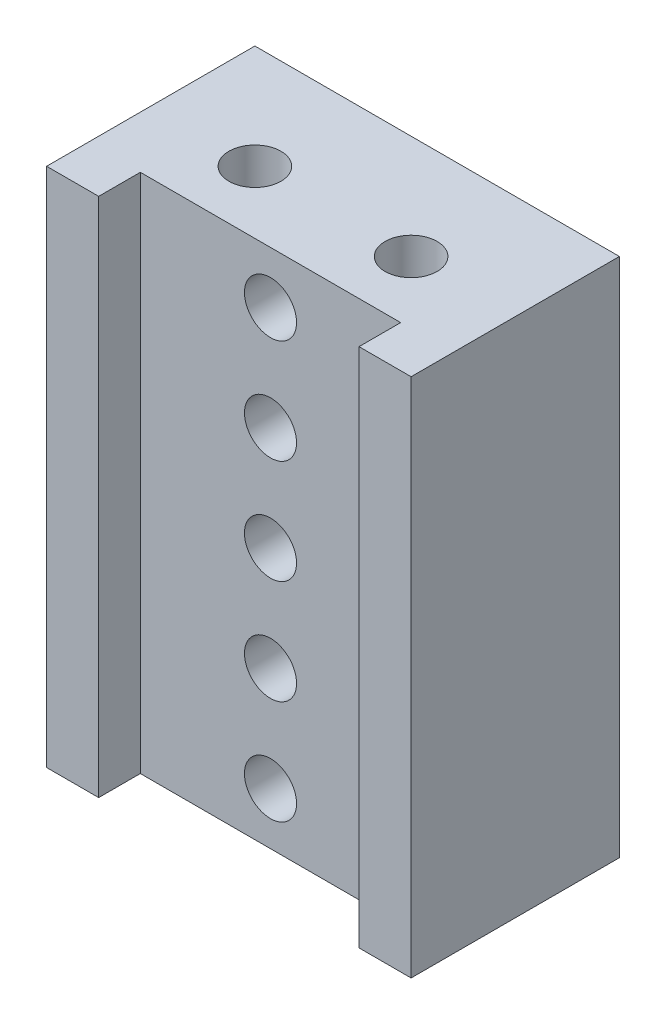
from build123d import *

# Parameters (mm, degrees)
BOSS_EXTRUDE1_DEPTH      = 25
BOSS_EXTRUDE1_DEPTH_BACK = 25
SKETCH1_W                = 35
SKETCH1_H                = 20
CUT_EXTRUDE1_DEPTH       = 54.909646632
CUT_EXTRUDE1_DEPTH_BACK  = 54.909646632
SKETCH2_R                = 2.5
CUT_EXTRUDE2_DEPTH       = 54.909646632
CUT_EXTRUDE2_DEPTH_BACK  = 54.909646632
SKETCH3_W                = 25
SKETCH3_H                = 4
CUT_EXTRUDE3_DEPTH       = 35.456494308
CUT_EXTRUDE3_DEPTH_BACK  = 35.456494308
SKETCH4_R                = 2.5


with BuildPart() as part:
    # Sketch1 → Boss-Extrude1 (new, two sides: drawn at the far end of the back side and taken through both)
    with BuildSketch(Plane(origin=(0, 0, 0), x_dir=(1, 0, 0), z_dir=(0, 1, 0)).offset(-BOSS_EXTRUDE1_DEPTH_BACK)):
        Rectangle(SKETCH1_W, SKETCH1_H)
    extrude(amount=BOSS_EXTRUDE1_DEPTH + BOSS_EXTRUDE1_DEPTH_BACK)

    # Sketch2 → Cut-Extrude1 (cut, two sides: drawn at the far end of the back side and taken through both)
    with BuildSketch(Plane(origin=(0, 25, 0), x_dir=(1, 0, 0), z_dir=(0, 1, 0)).offset(-CUT_EXTRUDE1_DEPTH_BACK)):
        with Locations((-7.5, 0)):
            Circle(SKETCH2_R)
        with Locations((7.5, 0)):
            Circle(SKETCH2_R)
    extrude(amount=CUT_EXTRUDE1_DEPTH + CUT_EXTRUDE1_DEPTH_BACK, mode=Mode.SUBTRACT)

    # Sketch3 → Cut-Extrude2 (cut, two sides: drawn at the far end of the back side and taken through both)
    with BuildSketch(Plane(origin=(0, 25, 0), x_dir=(1, 0, 0), z_dir=(0, 1, 0)).offset(-CUT_EXTRUDE2_DEPTH_BACK)):
        with Locations((0, -8)):
            Rectangle(SKETCH3_W, SKETCH3_H)
    extrude(amount=CUT_EXTRUDE2_DEPTH + CUT_EXTRUDE2_DEPTH_BACK, mode=Mode.SUBTRACT)

    # Sketch4 → Cut-Extrude3 (cut, two sides: drawn at the far end of the back side and taken through both)
    with BuildSketch(Plane.XY.offset(6).offset(-CUT_EXTRUDE3_DEPTH_BACK)):
        with Locations((0, -20)):
            Circle(SKETCH4_R)
        with Locations((0, -10)):
            Circle(SKETCH4_R)
        Circle(SKETCH4_R)
        with Locations((0, 10)):
            Circle(SKETCH4_R)
        with Locations((0, 20)):
            Circle(SKETCH4_R)
    extrude(amount=CUT_EXTRUDE3_DEPTH + CUT_EXTRUDE3_DEPTH_BACK, mode=Mode.SUBTRACT)


solid = part.part
